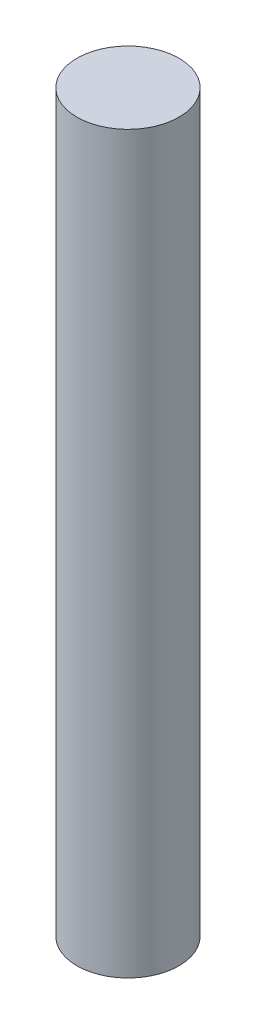
from build123d import *

# Parameters (mm, degrees)
SKETCH_1_R      = 5
EXTRUDE_1_DEPTH = 72


with BuildPart() as part:
    # 草图1 → 凸台-拉伸1 (new body)
    with BuildSketch(Plane(origin=(0, 0, 0), x_dir=(1, 0, 0), z_dir=(0, 1, 0))):
        Circle(SKETCH_1_R)
    extrude(amount=EXTRUDE_1_DEPTH)


solid = part.part
